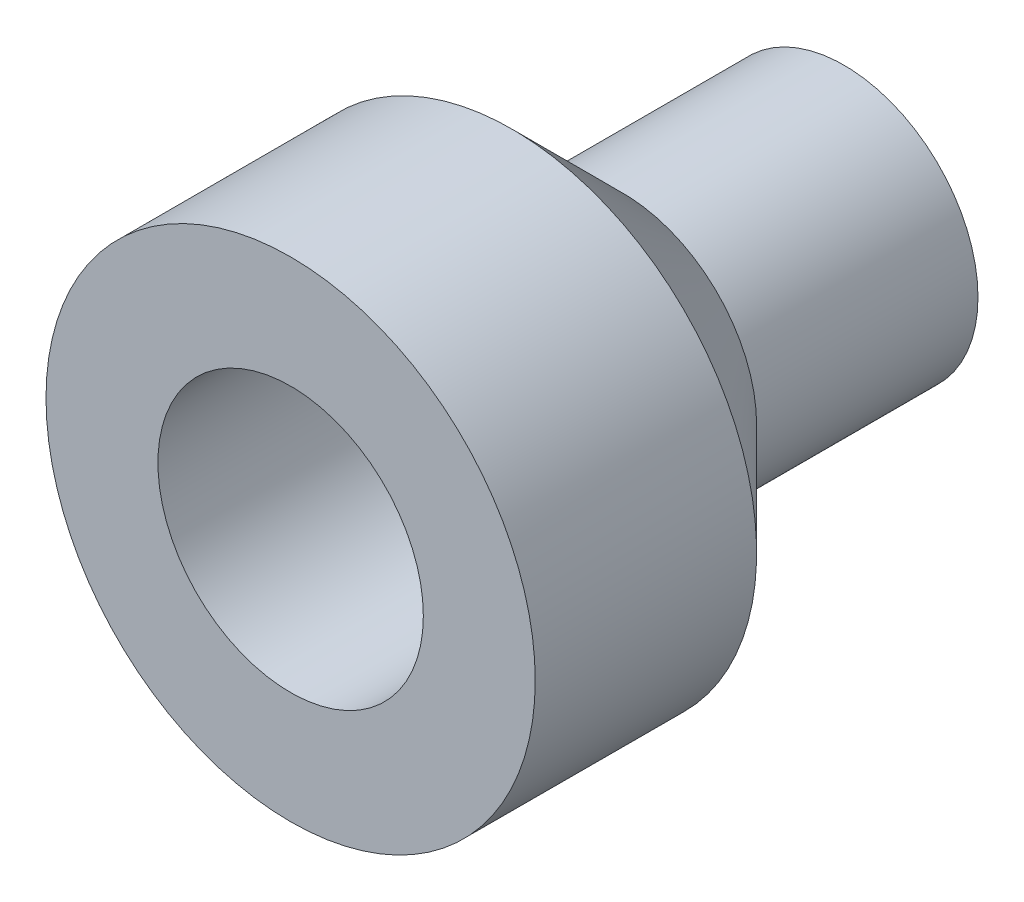
from build123d import *

# Parameters (mm, degrees)
SKETCH1_R           = 11.05
SKETCH1_R_2         = 6.05
BOSS_EXTRUDE1_DEPTH = 10
SKETCH2_R           = 6.05
BOSS_EXTRUDE2_DEPTH = 15
BOSS_EXTRUDE3_START = 5
SKETCH3_R           = 11.05
BOSS_EXTRUDE3_DEPTH = 5
CHAMFER1_SIZE       = 5
SKETCH4_R           = 6.05
SKETCH4_R_2         = 5.995
BOSS_EXTRUDE4_DEPTH = 10


with BuildPart() as part:
    # Sketch1 → Boss-Extrude1 (new body)
    with BuildSketch(Plane.XY):
        Circle(SKETCH1_R)
        Circle(SKETCH1_R_2, mode=Mode.SUBTRACT)
    extrude(amount=BOSS_EXTRUDE1_DEPTH)



with BuildPart() as body_2:
    # Sketch2 → Boss-Extrude2 (new body)
    with BuildSketch(Plane(origin=(0, 0, 0), x_dir=(-1, 0, 0), z_dir=(0, 0, -1))):
        with Locations(Location((0, 0, 0), (0, 0, 180))):
            Circle(SKETCH2_R)
    extrude(amount=BOSS_EXTRUDE2_DEPTH)


with BuildPart() as part_1:
    add(part.part)

    add(body_2.part)  # Boss-Extrude3 merges body 2
    # Sketch3 → Boss-Extrude3 (add)
    with BuildSketch(Plane(origin=(0, 0, 0), x_dir=(-1, 0, 0), z_dir=(0, 0, -1)).offset(BOSS_EXTRUDE3_START)):
        Circle(SKETCH3_R)
    extrude(amount=-BOSS_EXTRUDE3_DEPTH)

    # Chamfer1
    chamfer1_edges = [part_1.edges().sort_by_distance(p)[0] for p in [
        (11.05, 0, -5),
    ]]
    chamfer(chamfer1_edges, length=CHAMFER1_SIZE - 0.0001)  # a hair under: the kernel refuses the full size

    # Sketch4 → Boss-Extrude4 (add)
    with BuildSketch(Plane.XY.offset(10)):
        with Locations(Location((0, 0, 0), (0, 0, 180))):
            Circle(SKETCH4_R)
        Circle(SKETCH4_R_2, mode=Mode.SUBTRACT)
    extrude(amount=-BOSS_EXTRUDE4_DEPTH)


solid = part_1.part
